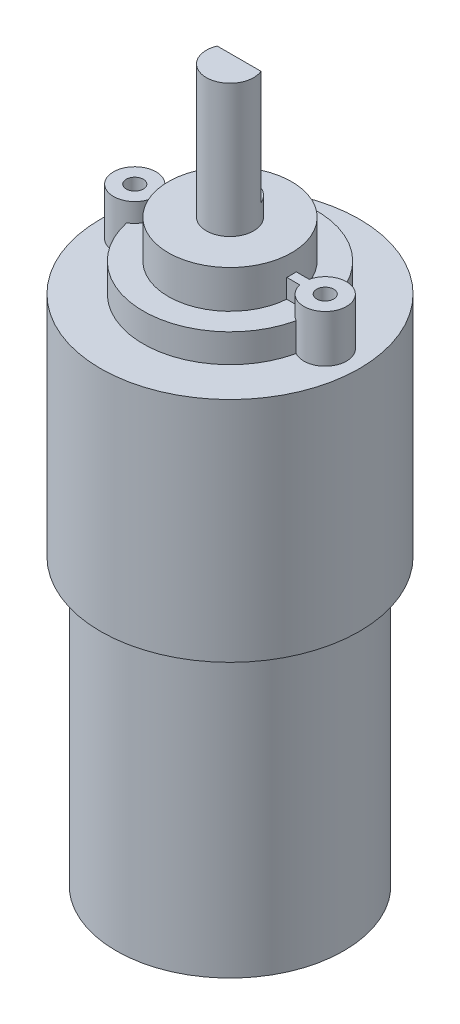
from build123d import *

# Parameters (mm, degrees)
CORTAR_EXTRUIR1_START   = -12
CORTAR_EXTRUIR1_DEPTH   = 12
CROQUIS4_R              = 0.9
SALIENTE_EXTRUIR1_DEPTH = 5


with BuildPart() as part:
    # Croquis1 → Revolución1 (revolve)
    with BuildSketch(Plane.XY):
        Polygon((0, -30.5), (0, 44.5), (-2.5, 44.5), (-2.5, 30.5), (-6.5, 30.5), (-6.5, 26.5), (-9.15, 26.5), (-9.15, 23.5), (-13.65, 23.5), (-13.65, -0.5), (-12, -0.5), (-12, -30.5), align=None)
    revolve(axis=Axis((0, 65.687156563, 0), (0, -1, 0)))

    # Croquis2 → Cortar-Extruir1 (cut)
    with BuildSketch(Plane(origin=(0, 44.5, 0), x_dir=(1, 0, 0), z_dir=(0, 1, 0)).offset(CORTAR_EXTRUIR1_START)):
        with BuildLine():
            ThreePointArc((2.308332732, 0.96), (0, 2.5), (-2.308332732, 0.96))
            Line((-2.308332732, 0.96), (2.308332732, 0.96))
        make_face()
    extrude(amount=CORTAR_EXTRUIR1_DEPTH, mode=Mode.SUBTRACT)

    # Croquis4 → Saliente-Extruir1 (add)
    with BuildSketch(Plane(origin=(0, 23.5, 0), x_dir=(1, 0, 0), z_dir=(0, 1, 0))):
        with BuildLine():
            ThreePointArc((7.846258903, -0.5), (12.29, 0), (7.846258903, 0.5))
            Line((7.846258903, 0.5), (-7.846258903, 0.5))
            ThreePointArc((-7.846258903, 0.5), (-12.29, 0), (-7.846258903, -0.5))
            Line((-7.846258903, -0.5), (7.846258903, -0.5))
        make_face()
        with Locations((10.04, 0)):
            Circle(CROQUIS4_R, mode=Mode.SUBTRACT)
        with Locations((-10.04, 0)):
            Circle(CROQUIS4_R, mode=Mode.SUBTRACT)
    extrude(amount=SALIENTE_EXTRUIR1_DEPTH)


solid = part.part
